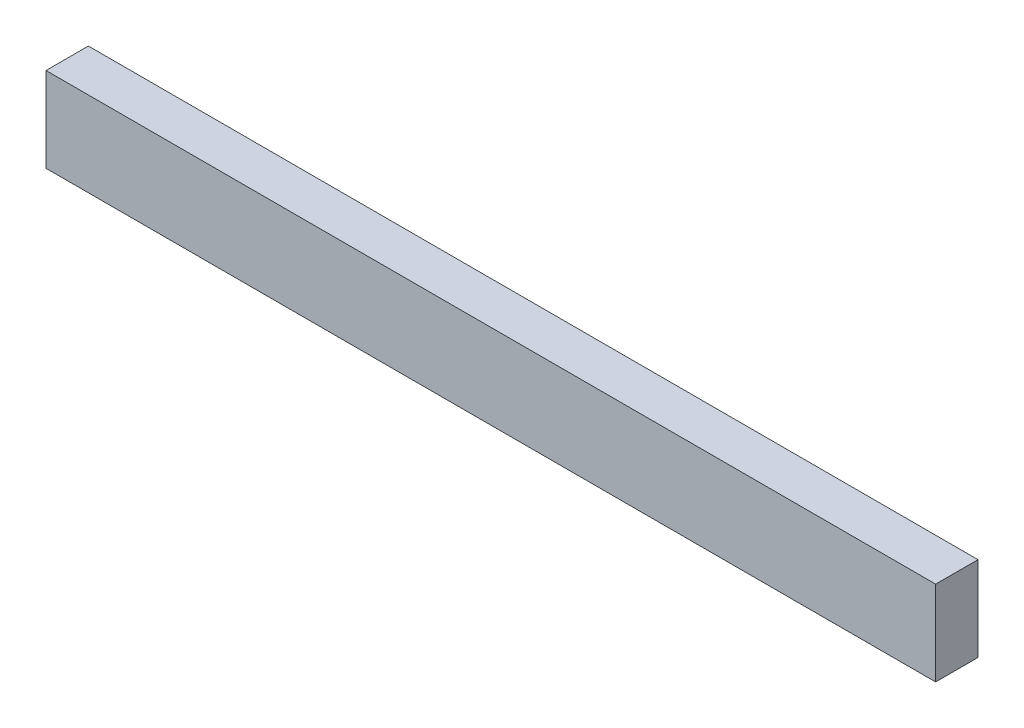
from build123d import *

# Parameters (mm, degrees)
SKETCH1_W           = 533.4
SKETCH1_H           = 50.8
BOSS_EXTRUDE1_DEPTH = 25.4


with BuildPart() as part:
    # Sketch1 → Boss-Extrude1 (new body)
    with BuildSketch(Plane.XY):
        with Locations((266.7, 25.4)):
            Rectangle(SKETCH1_W, SKETCH1_H)
    extrude(amount=BOSS_EXTRUDE1_DEPTH)


solid = part.part
